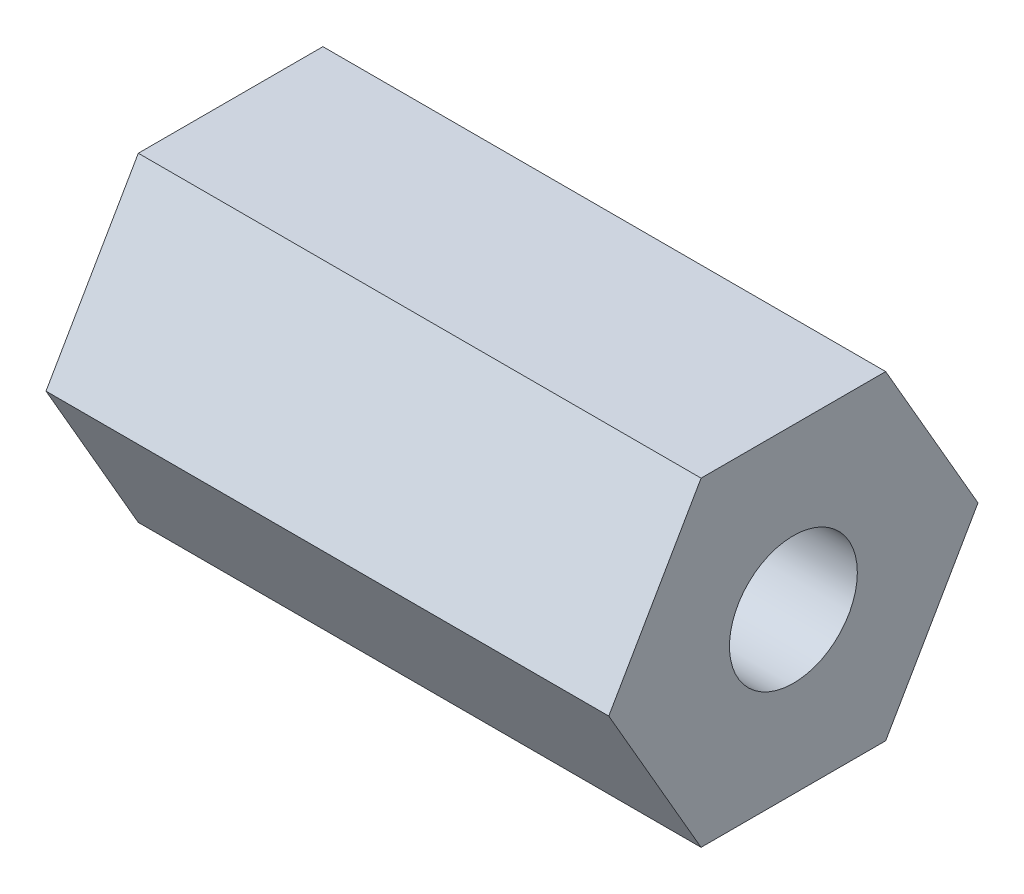
from build123d import *

# Parameters (mm, degrees)
BOSS_EXTRUDE1_DEPTH = 22.352
SKETCH4_R           = 2.54
CUT_EXTRUDE3_DEPTH  = 25.365913431


with BuildPart() as part:
    # Sketch1 → Boss-Extrude1 (new body)
    with BuildSketch(Plane(origin=(0, 0, 0), x_dir=(0, 0, -1), z_dir=(1, 0, 0))):
        Polygon((3.666174209, 6.35), (-3.666174209, 6.35), (-7.332348419, 0), (-3.666174209, -6.35), (3.666174209, -6.35), (7.332348419, 0), align=None)
    extrude(amount=BOSS_EXTRUDE1_DEPTH)

    # Sketch4 → Cut-Extrude3 (cut, through all)
    with BuildSketch(Plane(origin=(22.352, 0, 0), x_dir=(0, 0, -1), z_dir=(1, 0, 0))):
        Circle(SKETCH4_R)
    extrude(amount=-CUT_EXTRUDE3_DEPTH, mode=Mode.SUBTRACT)


solid = part.part
